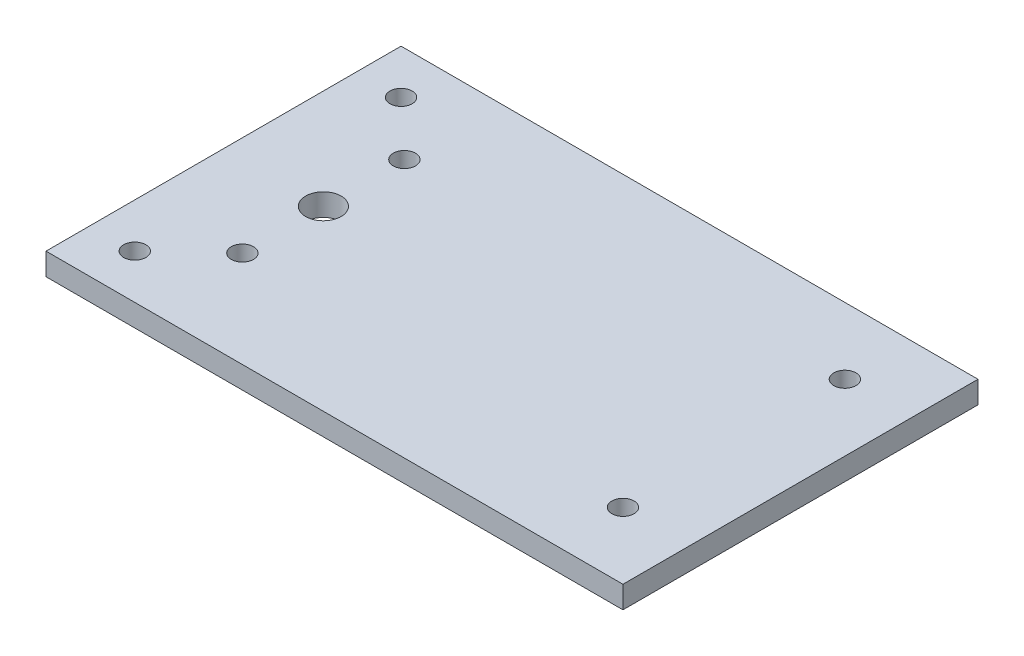
from build123d import *

# Parameters (mm, degrees)
SKETCH1_W           = 130
SKETCH1_H           = 80
SKETCH1_R           = 4
SKETCH1_R_2         = 2.5
BOSS_EXTRUDE1_DEPTH = 5


with BuildPart() as part:
    # Sketch1 → Boss-Extrude1 (new body)
    with BuildSketch(Plane(origin=(0, 0, 0), x_dir=(1, 0, 0), z_dir=(0, 1, 0))):
        with Locations((-4.718309859, -5.352112676)):
            Rectangle(SKETCH1_W, SKETCH1_H)
        with Locations((-47.218309859, -5.352112676)):
            Circle(SKETCH1_R, mode=Mode.SUBTRACT)
        with Locations((45.281690141, 19.647887324)):
            Circle(SKETCH1_R_2, mode=Mode.SUBTRACT)
        with Locations((-59.718309859, 24.647887324)):
            Circle(SKETCH1_R_2, mode=Mode.SUBTRACT)
        with Locations((45.281690141, -30.352112676)):
            Circle(SKETCH1_R_2, mode=Mode.SUBTRACT)
        with Locations((-59.718309859, -35.352112676)):
            Circle(SKETCH1_R_2, mode=Mode.SUBTRACT)
        with Locations((-47.218309859, 12.897887324)):
            Circle(SKETCH1_R_2, mode=Mode.SUBTRACT)
        with Locations((-47.218309859, -23.602112676)):
            Circle(SKETCH1_R_2, mode=Mode.SUBTRACT)
    extrude(amount=BOSS_EXTRUDE1_DEPTH)


solid = part.part
